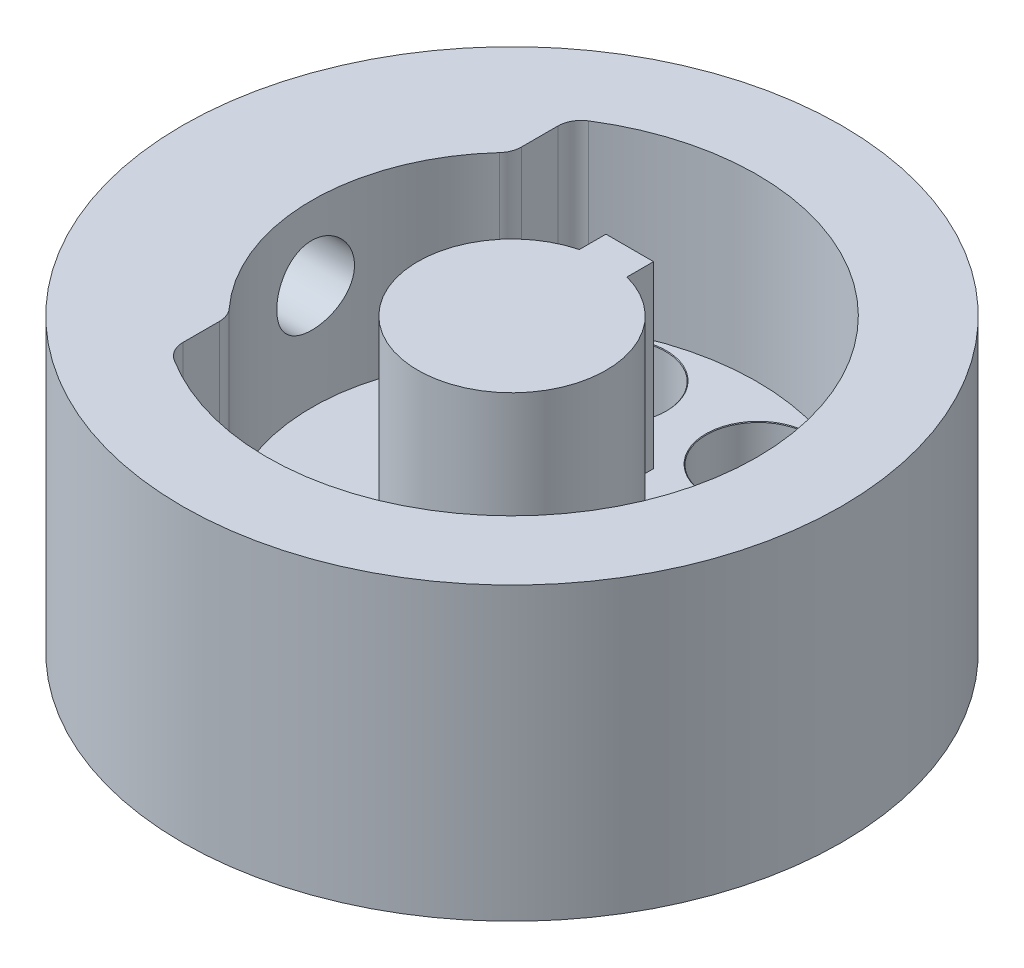
from build123d import *

# Parameters (mm, degrees)
SKETCH1_R                             = 14
BOSS_EXTRUDE1_DEPTH                   = 4.75
BOSS_EXTRUDE4_DEPTH                   = 7.61416499
BOSS_EXTRUDE5_START                   = 7.61416499
SKETCH5_R                             = 14
BOSS_EXTRUDE5_DEPTH                   = 7.61416499
TAP_DRILL_FOR_M4X0_7_TAP2_D           = 3.3
TAP_DRILL_FOR_M4X0_7_TAP2_DEPTH       = 13.749
TAP_DRILL_FOR_M4X0_7_TAP2_CSINK_D     = 3.35
TAP_DRILL_FOR_M4X0_7_TAP2_CSINK_ANGLE = 90
TAP_DRILL_FOR_M4X0_7_TAP2_TIP         = 0.991420021
FILLET2_R                             = 1
CBORE_FOR_M2_SHCS3_AT_2_COUNT         = 2
CBORE_FOR_M2_SHCS3_AT_2_PITCH         = 6.122934918
CBORE_FOR_M2_SHCS3_AT_3_COUNT         = 2
CBORE_FOR_M2_SHCS3_AT_3_PITCH         = 11.313708499
CBORE_FOR_M2_SHCS3_AT_4_COUNT         = 2
CBORE_FOR_M2_SHCS3_AT_4_PITCH         = 14.78207252
CBORE_FOR_M2_SHCS3_AT_5_COUNT         = 2
CBORE_FOR_M2_SHCS3_AT_5_PITCH         = 16
CBORE_FOR_M2_SHCS3_AT_6_COUNT         = 2
CBORE_FOR_M2_SHCS3_AT_6_PITCH         = 14.78207252
SKETCH20_R                            = 4
CUT_EXTRUDE2_DEPTH                    = 2.75
SKETCH21_R                            = 2
CUT_EXTRUDE3_DEPTH                    = 2.5


with BuildPart() as part:
    # Sketch1 → Boss-Extrude1 (new body)
    with BuildSketch(Plane(origin=(0, 0, 0), x_dir=(1, 0, 0), z_dir=(0, 1, 0))):
        Circle(SKETCH1_R)
    extrude(amount=-BOSS_EXTRUDE1_DEPTH)

    # Sketch4 → Boss-Extrude4 (add)
    with BuildSketch(Plane(origin=(0, 0, 0), x_dir=(1, 0, 0), z_dir=(0, 1, 0))):
        with BuildLine():
            Line((1.01, 3.870387577), (1.01, 4.999999997))
            Line((1.01, 4.999999997), (-1.01, 4.999999997))
            Line((-1.01, 4.999999997), (-1.01, 3.870387577))
            ThreePointArc((-1.01, 3.870387577), (0, -4), (1.01, 3.870387577))
        make_face()
    extrude(amount=BOSS_EXTRUDE4_DEPTH)

    # Sketch5 → Boss-Extrude5 (add)
    with BuildSketch(Plane(origin=(0, 0, 0), x_dir=(1, 0, 0), z_dir=(0, 1, 0)).offset(BOSS_EXTRUDE5_START)):
        Circle(SKETCH5_R)
        with BuildLine():
            Line((-6.01040764, 6.01040764), (-6.01040764, 8.487343518))
            ThreePointArc((-6.01040764, 8.487343518), (10.4, 0), (-6.01040764, -8.487343518))
            Line((-6.01040764, -8.487343518), (-6.01040764, -6.01040764))
            ThreePointArc((-6.01040764, -6.01040764), (-8.5, 0), (-6.01040764, 6.01040764))
        make_face(mode=Mode.SUBTRACT)
    extrude(amount=-BOSS_EXTRUDE5_DEPTH)

    # Tap Drill for M4x0.7 Tap2
    with Locations(Plane(origin=(-20, 0, 0), x_dir=(0, 0, -1), z_dir=(-1, 0, 0))):
        with Locations((0, -4.48916499)):
            CounterSinkHole(TAP_DRILL_FOR_M4X0_7_TAP2_D / 2, TAP_DRILL_FOR_M4X0_7_TAP2_CSINK_D / 2, depth=TAP_DRILL_FOR_M4X0_7_TAP2_DEPTH, counter_sink_angle=TAP_DRILL_FOR_M4X0_7_TAP2_CSINK_ANGLE)
            with Locations((0, 0, -(TAP_DRILL_FOR_M4X0_7_TAP2_DEPTH + TAP_DRILL_FOR_M4X0_7_TAP2_TIP / 2))):  # 118° drill point
                Cone(0, TAP_DRILL_FOR_M4X0_7_TAP2_D / 2, TAP_DRILL_FOR_M4X0_7_TAP2_TIP, mode=Mode.SUBTRACT)

    # Fillet2
    fillet2_edges = [part.edges().sort_by_distance(p)[0] for p in [
        (-6.01040764, 3.807082495, 8.487343518),
        (-6.01040764, 3.807082495, 6.01040764),
        (-6.01040764, 3.807082495, -6.01040764),
        (-6.01040764, 3.807082495, -8.487343518),
    ]]
    fillet(fillet2_edges, radius=FILLET2_R)

    # Sketch19 → CBORE for M2 SHCS3 (revolve, cut)
    with BuildSketch(Plane(origin=(-3.061467459, 0, -7.39103626), x_dir=(0, 0, 1), z_dir=(1, 0, 0))):
        Polygon((0, 0), (0, 5.471032743), (1.2, 4.75), (1.2, 3.5), (2.2, 3.5), (2.2, 0.025), (2.225, 0), align=None)
    cbore_for_m2_shcs3 = revolve(axis=Axis((-3.061467459, 6.35, -7.39103626), (0, -1, 0)), mode=Mode.SUBTRACT)

    # CBORE for M2 SHCS3 at 2: CBORE for M2 SHCS3 ×2
    with Locations(*[(i * CBORE_FOR_M2_SHCS3_AT_2_PITCH, 0, 0) for i in range(1, CBORE_FOR_M2_SHCS3_AT_2_COUNT)]):
        add(cbore_for_m2_shcs3, mode=Mode.SUBTRACT)

    # CBORE for M2 SHCS3 at 3: CBORE for M2 SHCS3 ×2
    with Locations(*[Vector(0.9238795325112845, 0, 0.38268343236509533) * (i * CBORE_FOR_M2_SHCS3_AT_3_PITCH) for i in range(1, CBORE_FOR_M2_SHCS3_AT_3_COUNT)]):
        add(cbore_for_m2_shcs3, mode=Mode.SUBTRACT)

    # CBORE for M2 SHCS3 at 4: CBORE for M2 SHCS3 ×2
    with Locations(*[Vector(0.7071067811865439, 0, 0.7071067811865512) * (i * CBORE_FOR_M2_SHCS3_AT_4_PITCH) for i in range(1, CBORE_FOR_M2_SHCS3_AT_4_COUNT)]):
        add(cbore_for_m2_shcs3, mode=Mode.SUBTRACT)

    # CBORE for M2 SHCS3 at 5: CBORE for M2 SHCS3 ×2
    with Locations(*[Vector(0.3826834323650841, 0, 0.9238795325112892) * (i * CBORE_FOR_M2_SHCS3_AT_5_PITCH) for i in range(1, CBORE_FOR_M2_SHCS3_AT_5_COUNT)]):
        add(cbore_for_m2_shcs3, mode=Mode.SUBTRACT)

    # CBORE for M2 SHCS3 at 6: CBORE for M2 SHCS3 ×2
    with Locations(*[(0, 0, i * CBORE_FOR_M2_SHCS3_AT_6_PITCH) for i in range(1, CBORE_FOR_M2_SHCS3_AT_6_COUNT)]):
        add(cbore_for_m2_shcs3, mode=Mode.SUBTRACT)

    # Sketch20 → Cut-Extrude2 (cut)
    with BuildSketch(Plane.XZ.offset(4.75)):
        Circle(SKETCH20_R)
    extrude(amount=-CUT_EXTRUDE2_DEPTH, mode=Mode.SUBTRACT)

    # Sketch21 → Cut-Extrude3 (cut)
    with BuildSketch(Plane(origin=(0, -2, 0), x_dir=(-1, 0, 0), z_dir=(0, -1, 0))):
        Circle(SKETCH21_R)
    extrude(amount=-CUT_EXTRUDE3_DEPTH, mode=Mode.SUBTRACT)


solid = part.part
